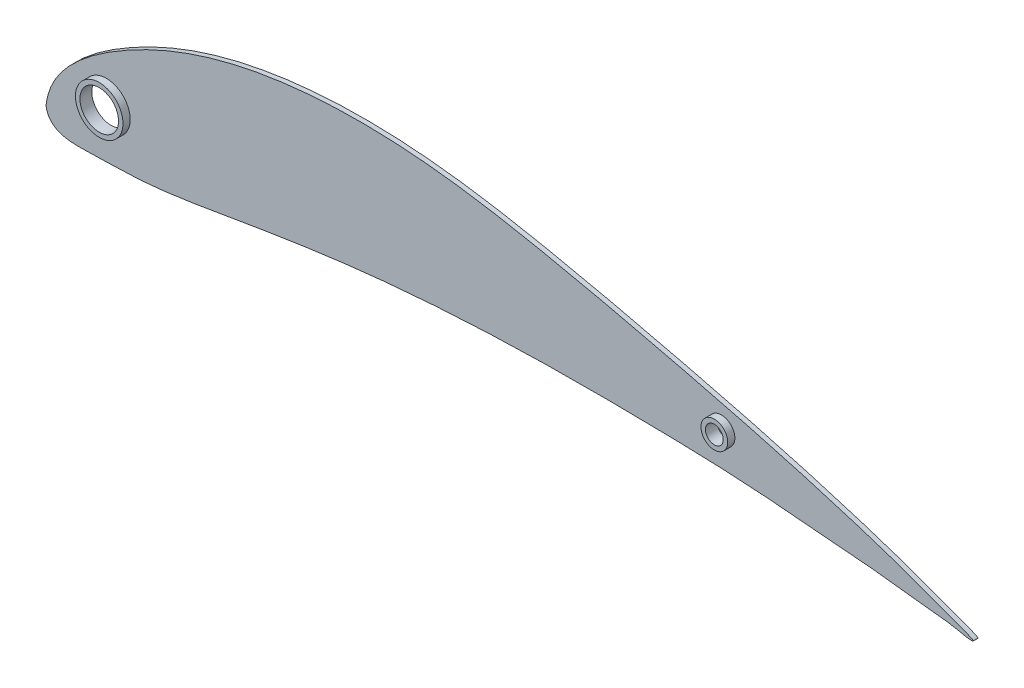
from build123d import *

# Parameters (mm, degrees)
BOSS_EXTRUDE1_DEPTH = 1.5875
SKETCH2_R           = 8
SKETCH2_R_2         = 6.5
SKETCH2_R_3         = 4.5
SKETCH2_R_4         = 3
BOSS_EXTRUDE2_DEPTH = 2.412500128
CUT_EXTRUDE1_START  = -4
SKETCH2_4_R         = 6.5
SKETCH2_4_R_2       = 3
CUT_EXTRUDE1_DEPTH  = 4


with BuildPart() as part:
    # Sketch1 → Boss-Extrude1 (new body)
    with BuildSketch(Plane.XY):
        with BuildLine():
            add(Edge.make_bspline(
                [(0.000560351, 0.000130087), (0.810633127, 7.359196055), (8.649092025, 17.856605174), (26.286719818, 29.975176328), (52.111128271, 42.069215275), (89.597618475, 49.290763054), (131.400792109, 47.884831915), (173.256699242, 40.041104278), (217.961060472, 29.612974894), (256.952064401, 19.528920948), (290.35983767, 8.71099439), (301.273197721, 4.382828139), (314.816918223, -0.516206742), (309.846313895, 0.000130087)],
                knots=[0, 0, 0, 0, 0.060863618, 0.113688265, 0.188608742, 0.312908923, 0.448482434, 0.557612135, 0.691544113, 0.852438279, 0.92975597, 0.976058229, 1, 1, 1, 1], degree=3))
            add(Edge.make_bspline(
                [(309.846313895, 0.000130087), (303.956832565, 1.47095521), (293.989507544, 2.093987313), (276.26402299, 4.514356704), (260.846344817, 5.427413394), (235.858814759, 7.870306192), (205.101424636, 8.838080282), (157.718638092, 9.030650149), (110.497331172, 6.181495223), (66.506197185, -0.586669107), (36.454672816, -6.098499901), (15.316603331, -6.189065841), (1.230714189, -6.924076091), (0.000560351, 0.000130087)],
                knots=[0, 0, 0, 0, 0.057787081, 0.095274891, 0.171021118, 0.205339302, 0.335319146, 0.464904334, 0.658702312, 0.785511947, 0.893517288, 0.94309214, 1, 1, 1, 1], degree=3))
        make_face()
    extrude(amount=BOSS_EXTRUDE1_DEPTH)

    # Sketch2 → Boss-Extrude2 (add)
    # profile 1 of 2: a face of its own
    with BuildSketch(Plane.XY.offset(1.5875)):
        with Locations((20.32, 10.16)):
            Circle(SKETCH2_R)
        with Locations((20.32, 10.16)):
            Circle(SKETCH2_R_2, mode=Mode.SUBTRACT)
    # profile 2 of 2: a face of its own
    with BuildSketch(Plane.XY.offset(1.5875)):
        with Locations((227.296313895, 19.050130087)):
            Circle(SKETCH2_R_3)
        with Locations((227.296313895, 19.050130087)):
            Circle(SKETCH2_R_4, mode=Mode.SUBTRACT)
    extrude(amount=BOSS_EXTRUDE2_DEPTH)

    # Sketch2<4> → Cut-Extrude1 (cut)
    with BuildSketch(Plane.XY.offset(1.5875).offset(CUT_EXTRUDE1_START)):
        with Locations((20.32, 10.16)):
            Circle(SKETCH2_4_R)
        with Locations((227.296313895, 19.050130087)):
            Circle(SKETCH2_4_R_2)
    extrude(amount=CUT_EXTRUDE1_DEPTH, mode=Mode.SUBTRACT)


solid = part.part
